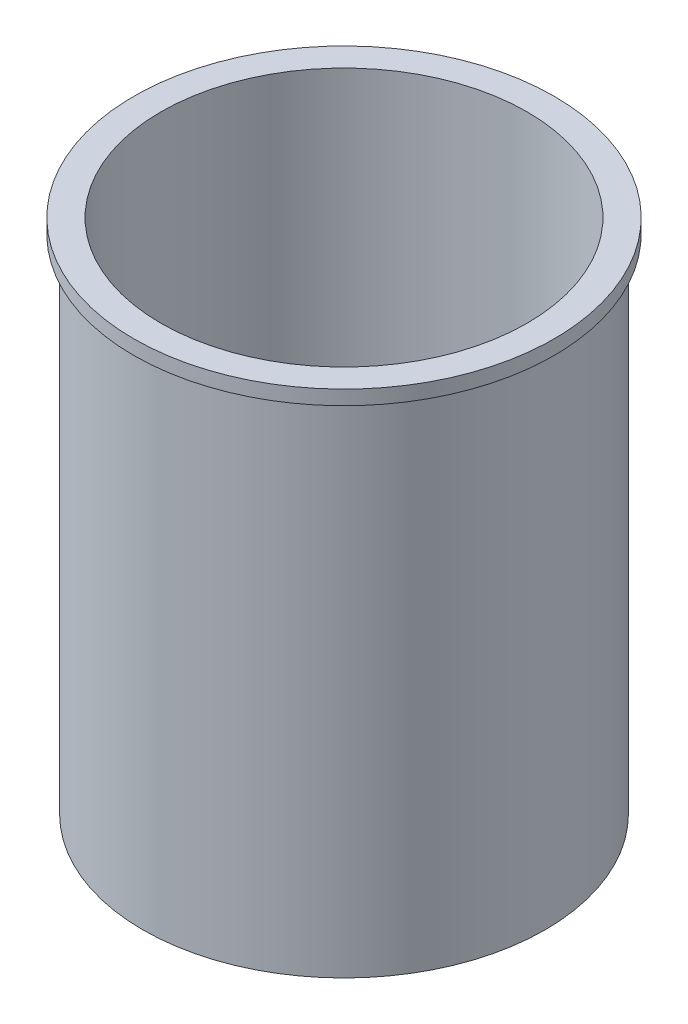
from build123d import *

# Parameters (mm, degrees)
POT_BASE_SKETCH_R   = 167.5
POT_BASE_DEPTH      = 15
POT_WALL_SKETCH_R   = 167.5
POT_WALL_SKETCH_R_2 = 152.5
POT_WALL_DEPTH      = 430
POT_START           = 418
POT_RIM_SKETCH_R    = 175
POT_RIM_SKETCH_R_2  = 152.5
POT_RIM_DEPTH       = 12


with BuildPart() as part:
    # Pot Base Sketch → Pot Base (new body)
    with BuildSketch(Plane(origin=(0, 0, 0), x_dir=(1, 0, 0), z_dir=(0, 1, 0))):
        Circle(POT_BASE_SKETCH_R)
    extrude(amount=POT_BASE_DEPTH)

    # Pot Wall Sketch → Pot Wall (add)
    with BuildSketch(Plane(origin=(0, 0, 0), x_dir=(1, 0, 0), z_dir=(0, 1, 0))):
        Circle(POT_WALL_SKETCH_R)
        Circle(POT_WALL_SKETCH_R_2, mode=Mode.SUBTRACT)
    extrude(amount=POT_WALL_DEPTH)

    # Pot Rim Sketch → Pot Rim (add)
    with BuildSketch(Plane(origin=(0, 0, 0), x_dir=(1, 0, 0), z_dir=(0, 1, 0)).offset(POT_START)):
        Circle(POT_RIM_SKETCH_R)
        Circle(POT_RIM_SKETCH_R_2, mode=Mode.SUBTRACT)
    extrude(amount=POT_RIM_DEPTH)


solid = part.part
